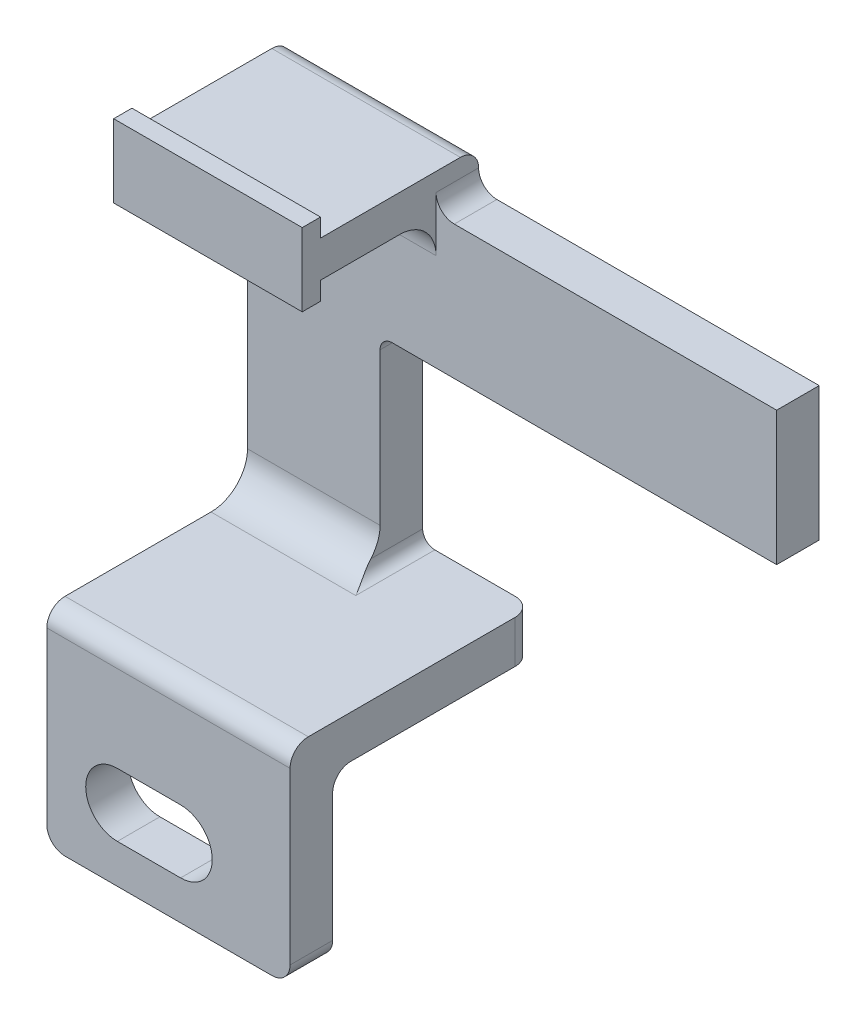
from build123d import *

# Parameters (mm, degrees)
BOSS_EXTRUDE1_DEPTH = 3.5
SKETCH2_W           = 20
SKETCH2_H           = 20
BOSS_EXTRUDE2_DEPTH = 3.5
SKETCH3_W           = 20
SKETCH3_H           = 3.5
BOSS_EXTRUDE3_DEPTH = 13.5
BOSS_EXTRUDE4_DEPTH = 3
SKETCH5_W           = 15.5
SKETCH5_H           = 6
BOSS_EXTRUDE5_DEPTH = 1.5
FILLET1_R           = 1
FILLET2_R           = 3
FILLET3_R           = 1.5
CUT_EXTRUDE1_DEPTH  = 3.5


with BuildPart() as part:
    # Sketch1 → Boss-Extrude1 (new body)
    with BuildSketch(Plane.XY):
        with BuildLine():
            Line((0, 0), (0, 15.5))
            ThreePointArc((0, 15.5), (0.292893219, 16.207106781), (1, 16.5))
            Line((1, 16.5), (32.6, 16.5))
            Line((32.6, 16.5), (32.6, 27.5))
            Line((32.6, 27.5), (-10.9, 27.5))
            Line((-10.9, 27.5), (-10.9, 0))
            Line((-10.9, 0), (0, 0))
        make_face()
    extrude(amount=BOSS_EXTRUDE1_DEPTH)

    # Sketch2 → Boss-Extrude2 (add)
    with BuildSketch(Plane.XZ):
        with Locations((-0.9, 10)):
            Rectangle(SKETCH2_W, SKETCH2_H)
    extrude(amount=BOSS_EXTRUDE2_DEPTH)

    # Sketch3 → Boss-Extrude3 (add)
    with BuildSketch(Plane.XZ.offset(3.5)):
        with Locations((-0.9, 18.25)):
            Rectangle(SKETCH3_W, SKETCH3_H)
    extrude(amount=BOSS_EXTRUDE3_DEPTH)

    # Sketch4 → Boss-Extrude4 (add)
    with BuildSketch(Plane(origin=(0, 27.5, 0), x_dir=(1, 0, 0), z_dir=(0, 1, 0))):
        Polygon((-10.9, 0), (-10.9, -3.5), (-10.9, -13), (4.6, -13), (4.6, -3.5), (4.6, 0), align=None)
    extrude(amount=BOSS_EXTRUDE4_DEPTH)

    # Sketch5 → Boss-Extrude5 (add)
    with BuildSketch(Plane.XY.offset(13)):
        with Locations((-3.15, 29)):
            Rectangle(SKETCH5_W, SKETCH5_H)
    extrude(amount=BOSS_EXTRUDE5_DEPTH)

    # Fillet1
    fillet1_edges = [part.edges().sort_by_distance(p)[0] for p in [
        (0, 0, 1.75),
    ]]
    fillet(fillet1_edges, radius=FILLET1_R)

    # Fillet2
    fillet2_edges = [part.edges().sort_by_distance(p)[0] for p in [
        (-4.95, 0, 3.5),
        (-3.15, 27.5, 3.5),
    ]]
    fillet(fillet2_edges, radius=FILLET2_R)

    # Fillet3
    fillet3_edges = [part.edges().sort_by_distance(p)[0] for p in [
        (9.1, -1.75, 0),
        (-0.9, -3.5, 16.5),
        (9.1, -17, 18.25),
        (-10.9, -17, 18.25),
        (4.6, 27.5, 1.75),
        (-3.15, 30.5, 0),
        (-0.9, 0, 20),
    ]]
    fillet(fillet3_edges, radius=FILLET3_R - 0.0001)  # a hair under: the kernel refuses the full size

    # Sketch6 → Cut-Extrude1 (cut)
    with BuildSketch(Plane(origin=(0, 0, 16.5), x_dir=(-1, 0, 0), z_dir=(0, 0, -1))):
        with BuildLine():
            ThreePointArc((5.1, -8.6), (3.261522369, -9.361522369), (2.5, -11.2))
            Line((2.5, -11.2), (7.7, -11.2))
            ThreePointArc((7.7, -11.2), (6.938477631, -9.361522369), (5.1, -8.6))
        make_face()
        with BuildLine():
            Line((7.7, -11.2), (2.5, -11.2))
            ThreePointArc((2.5, -11.2), (3.261522369, -13.038477631), (5.1, -13.8))
            ThreePointArc((5.1, -13.8), (6.938477631, -13.038477631), (7.7, -11.2))
        make_face()
        with BuildLine():
            ThreePointArc((5.1, -13.8), (3.261522369, -13.038477631), (2.5, -11.2))
            ThreePointArc((2.5, -11.2), (1.738477631, -13.038477631), (-0.1, -13.8))
            Line((-0.1, -13.8), (5.1, -13.8))
        make_face()
        with BuildLine():
            ThreePointArc((-0.1, -8.6), (1.738477631, -9.361522369), (2.5, -11.2))
            ThreePointArc((2.5, -11.2), (3.261522369, -9.361522369), (5.1, -8.6))
            Line((5.1, -8.6), (-0.1, -8.6))
        make_face()
        with BuildLine():
            ThreePointArc((-0.1, -13.8), (1.738477631, -13.038477631), (2.5, -11.2))
            Line((2.5, -11.2), (-2.7, -11.2))
            ThreePointArc((-2.7, -11.2), (-1.938477631, -13.038477631), (-0.1, -13.8))
        make_face()
        with BuildLine():
            Line((-2.7, -11.2), (2.5, -11.2))
            ThreePointArc((2.5, -11.2), (1.738477631, -9.361522369), (-0.1, -8.6))
            ThreePointArc((-0.1, -8.6), (-1.938477631, -9.361522369), (-2.7, -11.2))
        make_face()
    extrude(amount=-CUT_EXTRUDE1_DEPTH, mode=Mode.SUBTRACT)


solid = part.part
